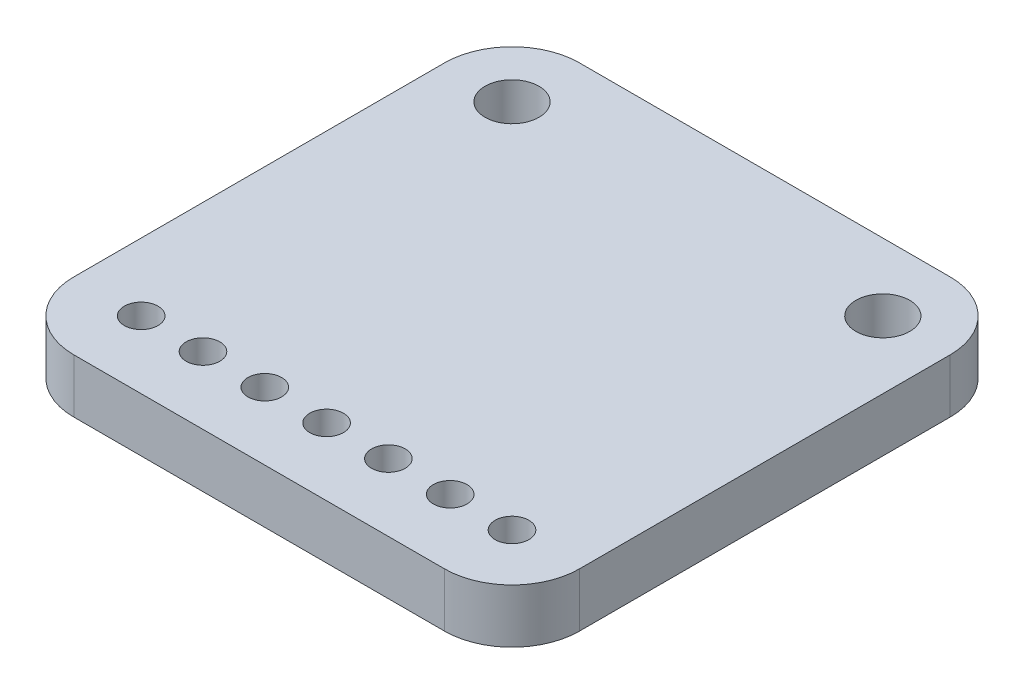
from build123d import *

# Parameters (mm, degrees)
BOSS_EXTRUDE1_DEPTH = 2.032
SKETCH2_R           = 1.016
SKETCH2_R_2         = 0.635
CUT_EXTRUDE1_DEPTH  = 28.017291204


with BuildPart() as part:
    # Sketch1 → Boss-Extrude1 (new body)
    with BuildSketch(Plane(origin=(0, 0, 0), x_dir=(1, 0, 0), z_dir=(0, 1, 0))):
        with BuildLine():
            Line((0, 2.54), (0, 16.51))
            ThreePointArc((0, 16.51), (0.743948776, 18.306051224), (2.54, 19.05))
            Line((2.54, 19.05), (16.51, 19.05))
            ThreePointArc((16.51, 19.05), (18.306051224, 18.306051224), (19.05, 16.51))
            Line((19.05, 16.51), (19.05, 2.54))
            ThreePointArc((19.05, 2.54), (18.306051224, 0.743948776), (16.51, 0))
            Line((16.51, 0), (2.54, 0))
            ThreePointArc((2.54, 0), (0.743948776, 0.743948776), (0, 2.54))
        make_face()
    extrude(amount=BOSS_EXTRUDE1_DEPTH)

    # Sketch2 → Cut-Extrude1 (cut, through all)
    with BuildSketch(Plane(origin=(0, 2.032, 0), x_dir=(1, 0, 0), z_dir=(0, 1, 0))):
        with Locations((2.54, 16.51)):
            Circle(SKETCH2_R)
        with Locations((16.51, 16.51)):
            Circle(SKETCH2_R)
        with Locations((2.54, 2.54)):
            Circle(SKETCH2_R_2)
        with Locations((4.868333333, 2.54)):
            Circle(SKETCH2_R_2)
        with Locations((7.196666667, 2.54)):
            Circle(SKETCH2_R_2)
        with Locations((9.525, 2.54)):
            Circle(SKETCH2_R_2)
        with Locations((11.853333333, 2.54)):
            Circle(SKETCH2_R_2)
        with Locations((14.181666667, 2.54)):
            Circle(SKETCH2_R_2)
        with Locations((16.51, 2.54)):
            Circle(SKETCH2_R_2)
    extrude(amount=-CUT_EXTRUDE1_DEPTH, mode=Mode.SUBTRACT)


solid = part.part
